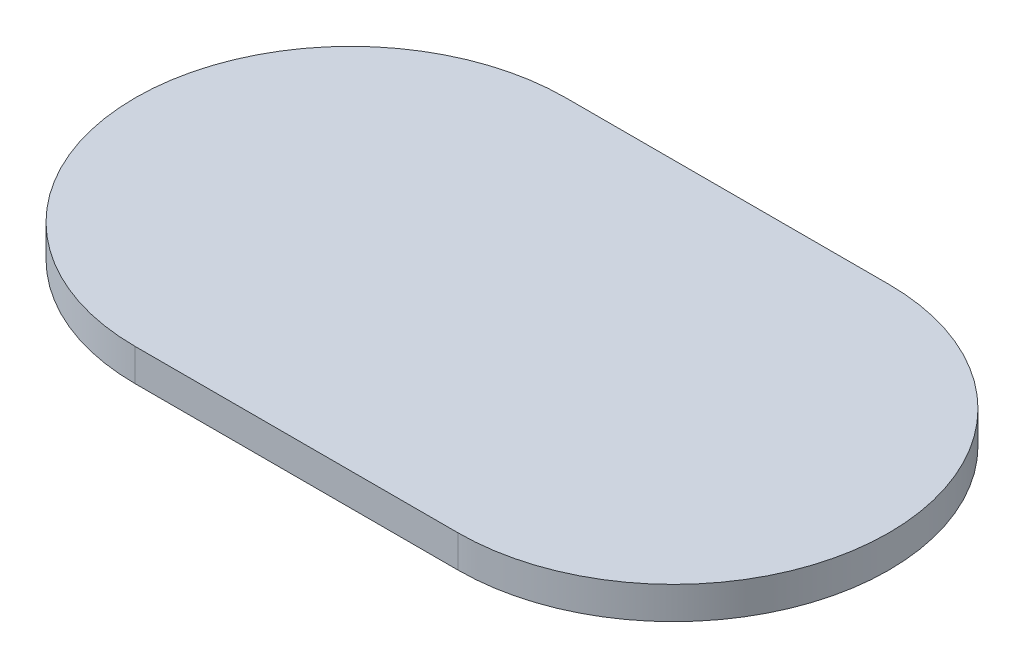
from build123d import *

# Parameters (mm, degrees)
BOSS_EXTRUDE1_DEPTH = 3


with BuildPart() as part:
    # Sketch2 → Boss-Extrude1 (new body)
    with BuildSketch(Plane(origin=(0, 0, 0), x_dir=(1, 0, 0), z_dir=(0, 1, 0))):
        with BuildLine():
            Line((15, 20), (-15, 20))
            ThreePointArc((-15, 20), (-35, 0), (-15, -20))
            Line((-15, -20), (15, -20))
            ThreePointArc((15, -20), (35, 0), (15, 20))
        make_face()
    extrude(amount=BOSS_EXTRUDE1_DEPTH)


solid = part.part
